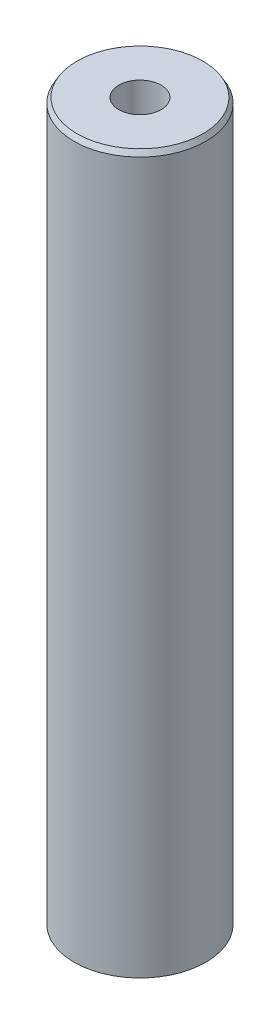
from build123d import *
from OCP.BRepFilletAPI import BRepFilletAPI_MakeChamfer

# Parameters (mm, degrees)
SKETCH1_R           = 55
BOSS_EXTRUDE1_DEPTH = 600
SKETCH2_R           = 17.71446587
CUT_EXTRUDE1_DEPTH  = 606.020660804
CHAMFER1_SIZE       = 4.258522717
CHAMFER1_SIZE2      = 2.458659237


with BuildPart() as part:
    # Sketch1 → Boss-Extrude1 (new body)
    with BuildSketch(Plane(origin=(0, 0, 0), x_dir=(1, 0, 0), z_dir=(0, 1, 0))):
        Circle(SKETCH1_R)
    extrude(amount=BOSS_EXTRUDE1_DEPTH)

    # Sketch2 → Cut-Extrude1 (cut, through all)
    with BuildSketch(Plane(origin=(0, 0, 0), x_dir=(1, 0, 0), z_dir=(0, 1, 0))):
        Circle(SKETCH2_R)
    extrude(amount=CUT_EXTRUDE1_DEPTH, mode=Mode.SUBTRACT)

    # Chamfer1: one chamfer whose edges measure the first distance from different faces: ONE call of the kernel's chamfer builder (chamfer() names one face for all edges)
    chamfer1_edges_1 = [part.edges().sort_by_distance(p)[0] for p in [
        (-55, 600, 0),
    ]]
    chamfer1_side_1 = [part.faces().sort_by_distance(p)[0] for p in [
        (-55, 300, 0),
    ]]
    chamfer1_edges_2 = [part.edges().sort_by_distance(p)[0] for p in [
        (-55, 0, 0),
    ]]
    chamfer1_side_2 = [part.faces().sort_by_distance(p)[0] for p in [
        (-53.444365081, 0, 0),
    ]]
    chamfer1 = BRepFilletAPI_MakeChamfer(part.part.solid().wrapped)
    for e in chamfer1_edges_1:
        chamfer1.Add(CHAMFER1_SIZE, CHAMFER1_SIZE2, e.wrapped, chamfer1_side_1[0].wrapped)  # the first distance lies on this face
    for e in chamfer1_edges_2:
        chamfer1.Add(CHAMFER1_SIZE, CHAMFER1_SIZE2, e.wrapped, chamfer1_side_2[0].wrapped)  # the first distance lies on this face
    add(Compound.cast(chamfer1.Shape()), mode=Mode.REPLACE)


solid = part.part
